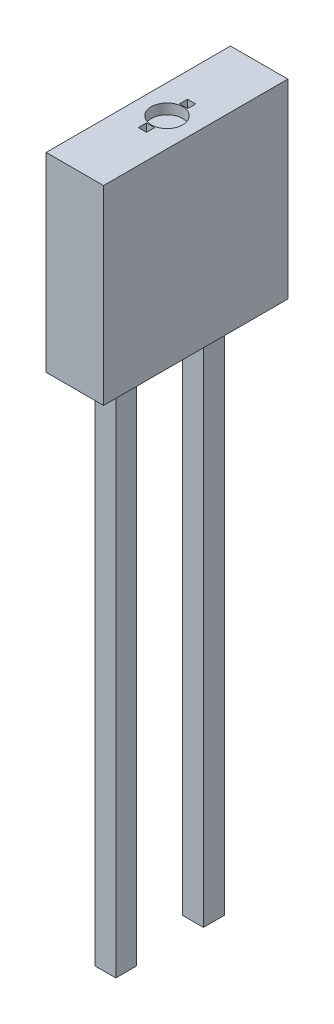
from build123d import *

# Parameters (mm, degrees)
CROQUIS1_W              = 1.4
CROQUIS1_H              = 4.5
SALIENTE_EXTRUIR1_DEPTH = 4.65
CROQUIS3_R              = 0.383471958
CORTAR_EXTRUIR1_DEPTH   = 0.25
CROQUIS4_W              = 0.2
CROQUIS4_H              = 0.2
CORTAR_EXTRUIR5_DEPTH   = 0.25
CROQUIS5_W              = 0.51
CROQUIS5_H              = 0.51
SALIENTE_EXTRUIR2_DEPTH = 12.7


with BuildPart() as part:
    # Croquis1 → Saliente-Extruir1 (new body)
    with BuildSketch(Plane(origin=(0, 0, 0), x_dir=(1, 0, 0), z_dir=(0, 1, 0))):
        with Locations((-0.7, -2.25)):
            Rectangle(CROQUIS1_W, CROQUIS1_H)
    extrude(amount=SALIENTE_EXTRUIR1_DEPTH)

    # Croquis3 → Cortar-Extruir1 (cut)
    with BuildSketch(Plane(origin=(0, 4.65, 0), x_dir=(1, 0, 0), z_dir=(0, 1, 0))):
        with Locations((-0.7, -2.25)):
            Circle(CROQUIS3_R)
    extrude(amount=-CORTAR_EXTRUIR1_DEPTH, mode=Mode.SUBTRACT)

    # Croquis4 → Cortar-Extruir5 (cut)
    with BuildSketch(Plane(origin=(0, 4.65, 0), x_dir=(1, 0, 0), z_dir=(0, 1, 0))):
        with Locations((-0.7, -1.75)):
            Rectangle(CROQUIS4_W, CROQUIS4_H)
        with Locations((-0.7, -2.75)):
            Rectangle(CROQUIS4_W, CROQUIS4_H)
    extrude(amount=-CORTAR_EXTRUIR5_DEPTH, mode=Mode.SUBTRACT)

    # Croquis5 → Saliente-Extruir2 (add)
    with BuildSketch(Plane.XZ):
        with Locations((-0.7, 3.5)):
            Rectangle(CROQUIS5_W, CROQUIS5_H)
        with Locations((-0.7, 1.361338898)):
            Rectangle(CROQUIS5_W, CROQUIS5_H)
    extrude(amount=SALIENTE_EXTRUIR2_DEPTH)


solid = part.part
